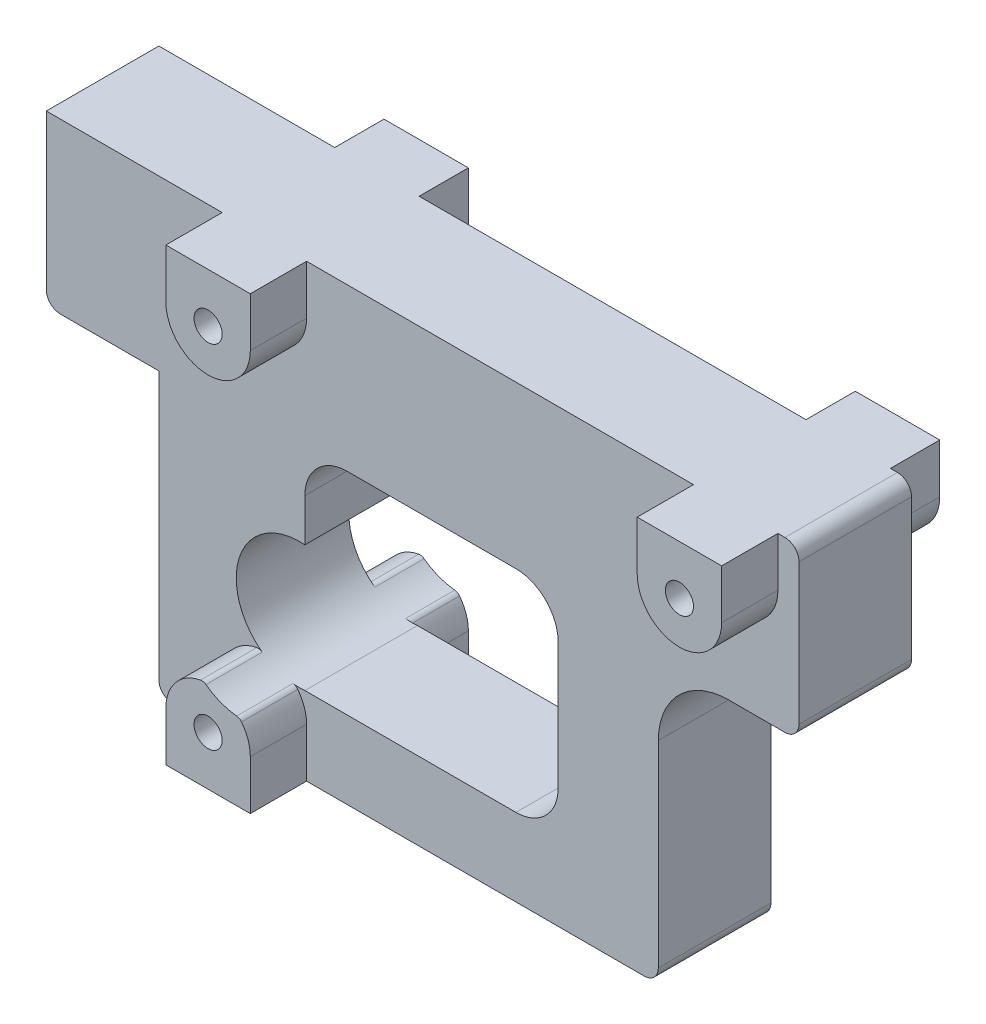
from build123d import *
from build123d.topology import SkipClean

# Parameters (mm, degrees)
SKETCH_2_R               = 4.5
EXTRUDE_1_DEPTH          = 8
EXTRUDE_2_DEPTH          = 4
EXTRUDE_2_DEPTH_BACK     = 11.5
CUT_EXTRUDE_1_DEPTH      = 41.717122437
CUT_EXTRUDE_1_DEPTH_BACK = 41.717122437
CUT_EXTRUDE_2_DEPTH      = 41.717122437
CUT_EXTRUDE_2_DEPTH_BACK = 41.717122437
SKETCH_6_R               = 1


with BuildPart() as part:
    # Эскиз2 → Бобышка-Вытянуть1 (new body)
    with BuildSketch(Plane.XY):
        with BuildLine():
            Line((-18.858561718, 18.044523082), (33.641438282, 18.044523082))
            ThreePointArc((33.641438282, 18.044523082), (34.348545063, 17.751629864), (34.641438282, 17.044523082))
            Line((34.641438282, 17.044523082), (34.641438282, 7.044523082))
            ThreePointArc((34.641438282, 7.044523082), (34.348545063, 6.337416301), (33.641438282, 6.044523082))
            Line((33.641438282, 6.044523082), (29.641438282, 6.044523082))
            ThreePointArc((29.641438282, 6.044523082), (26.105904376, 4.580056988), (24.641438282, 1.044523082))
            Line((24.641438282, 1.044523082), (24.641438282, -12.955476918))
            ThreePointArc((24.641438282, -12.955476918), (24.348545063, -13.662583699), (23.641438282, -13.955476918))
            Line((23.641438282, -13.955476918), (-9.858561718, -13.955476918))
            ThreePointArc((-9.858561718, -13.955476918), (-10.565668499, -13.662583699), (-10.858561718, -12.955476918))
            Line((-10.858561718, -12.955476918), (-10.858561718, 6.044523082))
            Line((-10.858561718, 6.044523082), (-17.858561718, 6.044523082))
            ThreePointArc((-17.858561718, 6.044523082), (-18.565668499, 6.337416301), (-18.858561718, 7.044523082))
            Line((-18.858561718, 7.044523082), (-18.858561718, 18.044523082))
        make_face()
        with Locations((-0.858561718, -3.955476918)):
            Circle(SKETCH_2_R, mode=Mode.SUBTRACT)
    extrude(amount=EXTRUDE_1_DEPTH)

    # Эскиз3 → Бобышка-Вытянуть2 (add, two sides: drawn at the far end of the back side and taken through both)
    with SkipClean():  # the faces are left unmerged after this step: merging them gives an invalid solid
        with BuildSketch(Plane.XY.offset(8).offset(-EXTRUDE_2_DEPTH_BACK)):
            with BuildLine():
                Line((27.141438282, 14.544523082), (27.141438282, 18.044523082))
                Line((27.141438282, 18.044523082), (33.141438282, 18.044523082))
                Line((33.141438282, 18.044523082), (33.141438282, 14.544523082))
                ThreePointArc((33.141438282, 14.544523082), (30.141438282, 11.544523082), (27.141438282, 14.544523082))
            make_face()
            with BuildLine():
                Line((-0.358561718, 14.544523082), (-0.358561718, 18.044523082))
                Line((-0.358561718, 18.044523082), (-6.358561718, 18.044523082))
                Line((-6.358561718, 18.044523082), (-6.358561718, 14.544523082))
                ThreePointArc((-6.358561718, 14.544523082), (-3.358561718, 11.544523082), (-0.358561718, 14.544523082))
            make_face()
            with BuildLine():
                Line((-6.358561718, -10.455476918), (-6.358561718, -13.955476918))
                Line((-6.358561718, -13.955476918), (-0.358561718, -13.955476918))
                Line((-0.358561718, -13.955476918), (-0.358561718, -10.455476918))
                ThreePointArc((-0.358561718, -10.455476918), (-0.519059003, -9.487373446), (-0.983377938, -8.622855294))
                ThreePointArc((-0.983377938, -8.622855294), (-1.135599023, -8.491670945), (-1.327173883, -8.4310107))
                ThreePointArc((-1.327173883, -8.4310107), (-2.473967575, -8.155532145), (-3.509794913, -7.591541073))
                ThreePointArc((-3.509794913, -7.591541073), (-3.692643427, -7.508192328), (-3.893539312, -7.503562458))
                ThreePointArc((-3.893539312, -7.503562458), (-5.661270208, -8.532579726), (-6.358561718, -10.455476918))
            make_face()
        extrude(amount=EXTRUDE_2_DEPTH + EXTRUDE_2_DEPTH_BACK)
    add(part.part.scale(1), mode=Mode.REPLACE)  # the faces are merged on a copy

    # Эскиз5 → Вырез-Вытянуть1 (cut, two sides: drawn at the far end of the back side and taken through both)
    with BuildSketch(Plane.XY.offset(8).offset(-CUT_EXTRUDE_1_DEPTH_BACK)):
        with BuildLine():
            Line((14.520862779, 6.560547497), (2.520862779, 6.560547497))
            ThreePointArc((2.520862779, 6.560547497), (0.399542436, 5.681867841), (-0.479137221, 3.560547497))
            Line((-0.479137221, 3.560547497), (-0.479137221, -8.439452503))
            Line((-0.479137221, -8.439452503), (14.520862779, -8.439452503))
            ThreePointArc((14.520862779, -8.439452503), (16.642183123, -7.560772847), (17.520862779, -5.439452503))
            Line((17.520862779, -5.439452503), (17.520862779, 3.560547497))
            ThreePointArc((17.520862779, 3.560547497), (16.642183123, 5.681867841), (14.520862779, 6.560547497))
        make_face()
    extrude(amount=CUT_EXTRUDE_1_DEPTH + CUT_EXTRUDE_1_DEPTH_BACK, mode=Mode.SUBTRACT)

    # Эскиз6 → Вырез-Вытянуть2 (cut, two sides: drawn at the far end of the back side and taken through both)
    with BuildSketch(Plane.XY.offset(8).offset(-CUT_EXTRUDE_2_DEPTH_BACK)):
        with Locations((-3.358561718, 14.544523082)):
            Circle(SKETCH_6_R)
        with Locations((30.141438282, 14.544523082)):
            Circle(SKETCH_6_R)
        with Locations((-3.358561718, -10.455476918)):
            Circle(SKETCH_6_R)
    extrude(amount=CUT_EXTRUDE_2_DEPTH + CUT_EXTRUDE_2_DEPTH_BACK, mode=Mode.SUBTRACT)


solid = part.part
